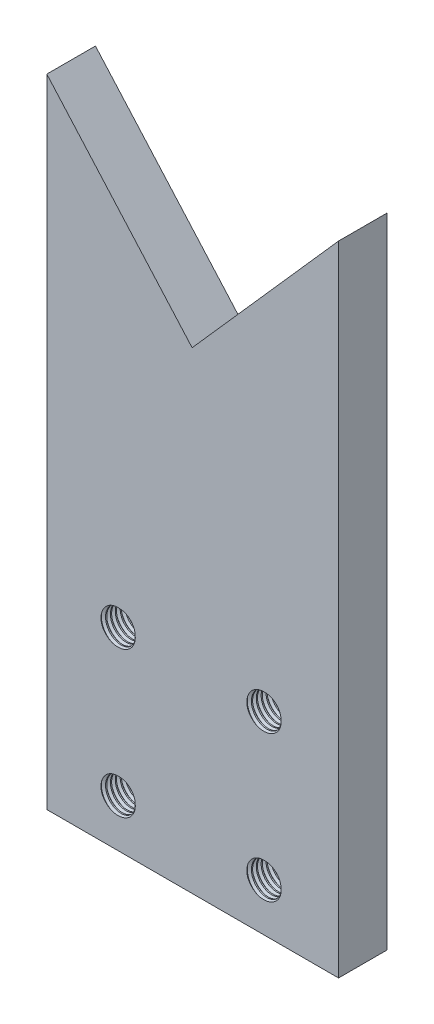
from build123d import *

# Parameters (mm, degrees)
BOSS_EXTRUDE1_DEPTH  = 12.7
SKETCH2_R            = 4.191
CUT_EXTRUDE1_DEPTH   = 107.984732629
LPATTERN1_COUNT      = 2
LPATTERN1_PITCH      = 38.1
LPATTERN1_COUNT_DIR2 = 2
LPATTERN1_PITCH_DIR2 = 38.1
THREAD1_PITCH        = 1.27
LPATTERN2_COUNT      = 2
LPATTERN2_PITCH      = 38.1
LPATTERN2_COUNT_DIR2 = 2
LPATTERN2_PITCH_DIR2 = 38.1


with BuildPart() as part:
    # Sketch1 → Boss-Extrude1 (new body)
    with BuildSketch(Plane.XY):
        Polygon((-37.951012393, -67.603767519), (38.248987607, -67.603767519), (38.248987607, 99.103269183), (0, 55.840232481), (-37.951012393, 98.766232481), align=None)
    extrude(amount=BOSS_EXTRUDE1_DEPTH)

    # Sketch2 → Cut-Extrude1 (cut, through all)
    with BuildSketch(Plane.XY.offset(12.7)):
        with Locations((19.05, -54.903767519)):
            Circle(SKETCH2_R)
    cut_extrude1 = extrude(amount=-CUT_EXTRUDE1_DEPTH, mode=Mode.SUBTRACT)

    # LPattern1: Cut-Extrude1 2 × 2
    with Locations(*[(-j * LPATTERN1_PITCH_DIR2, i * LPATTERN1_PITCH, 0) for i in range(LPATTERN1_COUNT) for j in range(LPATTERN1_COUNT_DIR2) if (i, j) != (0, 0)]):
        add(cut_extrude1, mode=Mode.SUBTRACT)

    # Thread1: the profile of Thread Profile1 profile screwed along a right-hand helix of 10 turns, 8 arcs to a turn; built about Z, then put on its axis
    thread1_z = Axis((0, 0, 0), (0, 0, 1))
    thread1_corners = [(4.1907, 0, -0.000173205), (4.878407661, 0, 0.396874998), (4.878407661, 0, 0.555624998), (4.1907, 0, 0.952673202)]
    with BuildLine(mode=Mode.PRIVATE) as thread1_profile:
        Line(thread1_corners[0], thread1_corners[1])
        Line(thread1_corners[1], thread1_corners[2])
        Line(thread1_corners[2], thread1_corners[3])
        Line(thread1_corners[3], thread1_corners[0])
    thread1_cap = Face(thread1_profile.wire())
    thread1_turn_angles = [0, 22.5, 45, 67.5, 90, 112.5, 135, 157.5, 180, 202.5, 225, 247.5, 270, 292.5, 315, 337.5, 360]
    thread1_turn_weights = [1, 0.9238795325112867, 1, 0.9238795325112867, 1, 0.9238795325112867, 1, 0.9238795325112867, 1, 0.9238795325112867, 1, 0.9238795325112867, 1, 0.9238795325112867, 1, 0.9238795325112867, 1]
    thread1_turn_rails = [Edge.make_bspline([Vector(p[0], p[1], 0).rotate(thread1_z, thread1_turn_angles[k]) / thread1_turn_weights[k] + Vector(0, 0, p[2] + THREAD1_PITCH * thread1_turn_angles[k] / 360) for k in range(17)], [0, 0, 0, 1, 1, 2, 2, 3, 3, 4, 4, 5, 5, 6, 6, 7, 7, 8, 8, 8], 2, thread1_turn_weights) for p in thread1_corners]
    thread1_turn_sides = [Face.make_surface_from_curves(thread1_turn_rails[p[0]], thread1_turn_rails[p[1]]) for p in [(0, 1), (1, 2), (2, 3), (3, 0)]]
    thread1 = Plane(origin=(19.05, -54.903767519, 0), x_dir=(1, 0, 0), z_dir=(0, 0, 1)) * Solid(Shell([*[p.moved(Location((0, 0, THREAD1_PITCH * i))) for i in range(10) for p in thread1_turn_sides], thread1_cap, thread1_cap.rotate(thread1_z, 3600).moved(Location((0, 0, THREAD1_PITCH * 3600 / 360)))]))
    add(thread1, mode=Mode.SUBTRACT)

    # LPattern2: Thread1 2 × 2
    with Locations(*[(-j * LPATTERN2_PITCH_DIR2, i * LPATTERN2_PITCH, 0) for i in range(LPATTERN2_COUNT) for j in range(LPATTERN2_COUNT_DIR2) if (i, j) != (0, 0)]):
        add(thread1, mode=Mode.SUBTRACT)


solid = part.part
